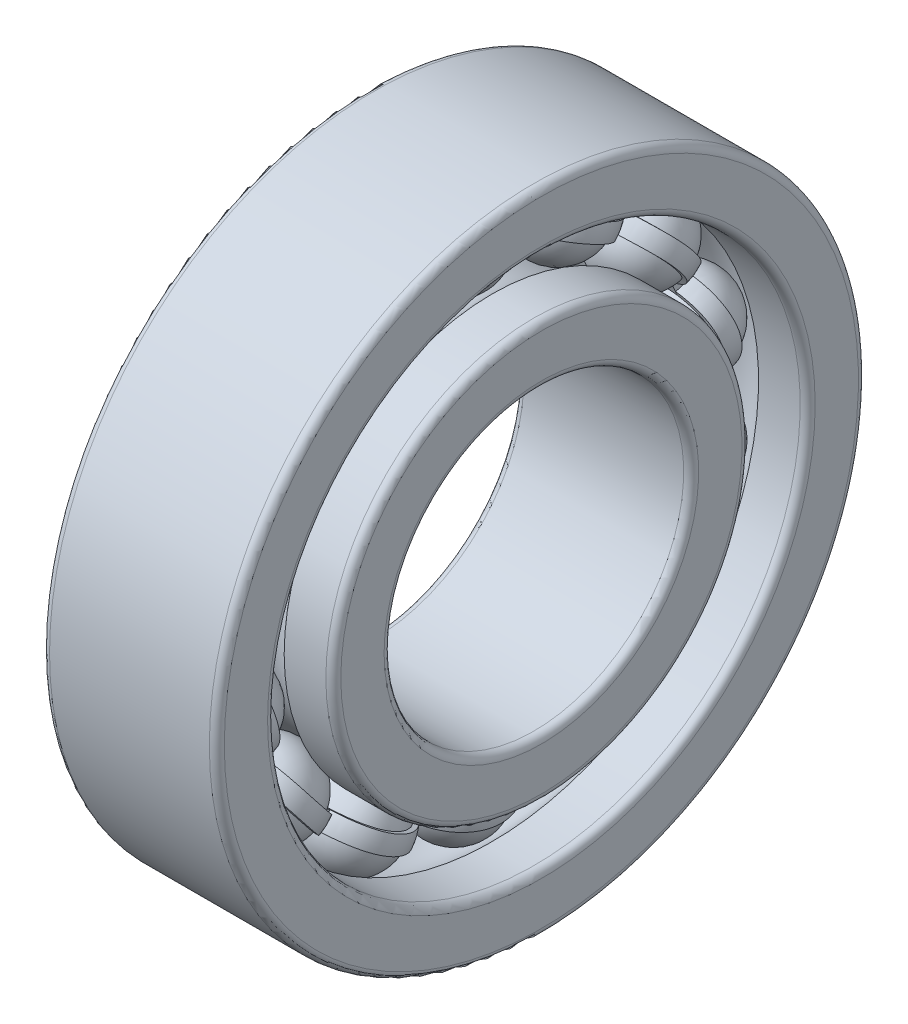
from build123d import *

# Parameters (mm, degrees)
SKETCH_5_W               = 0.5249999999999999
SKETCH_5_H               = 0.34999999999999964
PATTERN_CIRCULAR_5_COUNT = 14
PATTERN_CIRCULAR_2_COUNT = 14


with BuildPart() as part:
    # 草图2 → 旋转1 (revolve)
    with BuildSketch(Plane.XY):
        with BuildLine():
            Line((1.6000000000000028, 3), (-1.5999999999999979, 2.999999999999999))
            ThreePointArc((-1.5999999999999979, 2.999999999999999), (-1.7060660171779807, 3.043933982822017), (-1.749999999999999, 3.15))
            Line((-1.749999999999999, 3.15), (-1.7499999999999984, 4.016666666666998))
            ThreePointArc((-1.7499999999999984, 4.016666666666998), (-1.7060660171779811, 4.122732683844981), (-1.5999999999999985, 4.166666666666999))
            Line((-1.5999999999999985, 4.166666666666999), (-0.6521864934378441, 4.166666666666999))
            ThreePointArc((-0.6521864934378441, 4.166666666666999), (9.9e-16, 3.874999999999917), (0.6521864934378441, 4.166666666666999))
            Line((0.6521864934378441, 4.166666666666999), (1.600000000000003, 4.166666666666999))
            ThreePointArc((1.600000000000003, 4.166666666666999), (1.7060660171779847, 4.122732683844981), (1.7500000000000024, 4.016666666666999))
            Line((1.7500000000000024, 4.016666666666999), (1.7500000000000027, 3.15))
            ThreePointArc((1.7500000000000027, 3.15), (1.7060660171779847, 3.043933982822018), (1.6000000000000028, 3))
        make_face()
        with BuildLine():
            Line((-1.7499999999999984, 6.349999999999998), (-1.749999999999998, 5.483333333333333))
            ThreePointArc((-1.749999999999998, 5.483333333333333), (-1.7060660171779802, 5.3772673161553515), (-1.5999999999999979, 5.333333333333334))
            Line((-1.5999999999999979, 5.333333333333334), (-0.652186493437546, 5.333333333333332))
            ThreePointArc((-0.652186493437546, 5.333333333333332), (8e-16, 5.625000000000076), (0.652186493437546, 5.333333333333332))
            Line((0.652186493437546, 5.333333333333332), (1.6000000000000028, 5.333333333333332))
            ThreePointArc((1.6000000000000028, 5.333333333333332), (1.7060660171779845, 5.37726731615535), (1.7500000000000018, 5.483333333333332))
            Line((1.7500000000000018, 5.483333333333332), (1.7500000000000029, 6.349999999999998))
            ThreePointArc((1.7500000000000029, 6.349999999999998), (1.706066017177985, 6.456066017177981), (1.6000000000000025, 6.499999999999999))
            Line((1.6000000000000025, 6.499999999999999), (-1.599999999999998, 6.499999999999999))
            ThreePointArc((-1.599999999999998, 6.499999999999999), (-1.7060660171779811, 6.456066017177981), (-1.7499999999999984, 6.349999999999998))
        make_face()
    revolve(axis=Axis((-3.4999999999999996, 0, 0), (1, 0, 0)))


with BuildPart() as body_2:
    # 草图5 → 旋转3 (revolve)
    with BuildSketch(Plane.XY):
        with Locations((2.03e-15, 4.749999999999999)):
            Rectangle(SKETCH_5_W, SKETCH_5_H)
    revolve(axis=Axis((-19.927092192426834, 0, 0), (1, 0, 0)))



with BuildPart() as body_3:
    # 草图3 → 旋转2 (revolve)
    with BuildSketch(Plane.XY):
        with BuildLine():
            ThreePointArc((0.9624999999999972, 4.749999999999999), (1.9e-16, 5.712499999999992), (-0.962499999999997, 4.749999999999999))
            Line((-0.9624999999999969, 4.749999999999999), (0.9624999999999969, 4.749999999999999))
        make_face()
    revolve(axis=Axis((-0.9624999999999969, 4.749999999999999, 0), (1, 0, 0)))


with BuildPart() as pattern_circular_5_1:
    # 阵列(圆周)5: pattern copy
    add(body_3.part.rotate(Axis((-3.850000000000002, 0, 0), (1, 0, 0)), 1 * 360 / PATTERN_CIRCULAR_5_COUNT))


with BuildPart() as pattern_circular_5_2:
    # 阵列(圆周)5: pattern copy
    add(body_3.part.rotate(Axis((-3.850000000000002, 0, 0), (1, 0, 0)), 2 * 360 / PATTERN_CIRCULAR_5_COUNT))


with BuildPart() as pattern_circular_5_3:
    # 阵列(圆周)5: pattern copy
    add(body_3.part.rotate(Axis((-3.850000000000002, 0, 0), (1, 0, 0)), 3 * 360 / PATTERN_CIRCULAR_5_COUNT))


with BuildPart() as pattern_circular_5_4:
    # 阵列(圆周)5: pattern copy
    add(body_3.part.rotate(Axis((-3.850000000000002, 0, 0), (1, 0, 0)), 4 * 360 / PATTERN_CIRCULAR_5_COUNT))


with BuildPart() as pattern_circular_5_5:
    # 阵列(圆周)5: pattern copy
    add(body_3.part.rotate(Axis((-3.850000000000002, 0, 0), (1, 0, 0)), 5 * 360 / PATTERN_CIRCULAR_5_COUNT))


with BuildPart() as pattern_circular_5_6:
    # 阵列(圆周)5: pattern copy
    add(body_3.part.rotate(Axis((-3.850000000000002, 0, 0), (1, 0, 0)), 6 * 360 / PATTERN_CIRCULAR_5_COUNT))


with BuildPart() as pattern_circular_5_7:
    # 阵列(圆周)5: pattern copy
    add(body_3.part.rotate(Axis((-3.850000000000002, 0, 0), (1, 0, 0)), 7 * 360 / PATTERN_CIRCULAR_5_COUNT))


with BuildPart() as pattern_circular_5_8:
    # 阵列(圆周)5: pattern copy
    add(body_3.part.rotate(Axis((-3.850000000000002, 0, 0), (1, 0, 0)), 8 * 360 / PATTERN_CIRCULAR_5_COUNT))


with BuildPart() as pattern_circular_5_9:
    # 阵列(圆周)5: pattern copy
    add(body_3.part.rotate(Axis((-3.850000000000002, 0, 0), (1, 0, 0)), 9 * 360 / PATTERN_CIRCULAR_5_COUNT))


with BuildPart() as pattern_circular_5_10:
    # 阵列(圆周)5: pattern copy
    add(body_3.part.rotate(Axis((-3.850000000000002, 0, 0), (1, 0, 0)), 10 * 360 / PATTERN_CIRCULAR_5_COUNT))


with BuildPart() as pattern_circular_5_11:
    # 阵列(圆周)5: pattern copy
    add(body_3.part.rotate(Axis((-3.850000000000002, 0, 0), (1, 0, 0)), 11 * 360 / PATTERN_CIRCULAR_5_COUNT))


with BuildPart() as pattern_circular_5_12:
    # 阵列(圆周)5: pattern copy
    add(body_3.part.rotate(Axis((-3.850000000000002, 0, 0), (1, 0, 0)), 12 * 360 / PATTERN_CIRCULAR_5_COUNT))


with BuildPart() as pattern_circular_5_13:
    # 阵列(圆周)5: pattern copy
    add(body_3.part.rotate(Axis((-3.850000000000002, 0, 0), (1, 0, 0)), 13 * 360 / PATTERN_CIRCULAR_5_COUNT))


with BuildPart() as cut_revolve_1_tool:
    # 草图6 → 切除-旋转1 (revolve)
    with BuildSketch(Plane.XY):
        with BuildLine():
            Line((-0.9464572098092942, 4.924999999999999), (0.9464572098092942, 4.924999999999999))
            ThreePointArc((0.9464572098092942, 4.924999999999999), (2.49e-15, 5.712499999999993), (-0.9464572098092942, 4.924999999999999))
        make_face()
        with BuildLine():
            Line((-0.9464572098092942, 4.574999999999999), (0.9464572098092942, 4.574999999999999))
            ThreePointArc((0.9464572098092942, 4.574999999999999), (2.49e-15, 3.787499999999999), (-0.9464572098092942, 4.574999999999999))
        make_face()
    revolve(axis=Axis((-19.927092192426834, 0, 0), (1, 0, 0)))


with BuildPart() as part_1:
    add(part.part)

    # 切除-旋转1: cut by cut_revolve_1_tool
    add(cut_revolve_1_tool.part, mode=Mode.SUBTRACT)


with BuildPart() as body_3_1:
    add(body_3.part)

    # 切除-旋转1: cut by cut_revolve_1_tool
    add(cut_revolve_1_tool.part, mode=Mode.SUBTRACT)


with BuildPart() as pattern_circular_5_1_1:
    add(pattern_circular_5_1.part)

    # 切除-旋转1: cut by cut_revolve_1_tool
    add(cut_revolve_1_tool.part, mode=Mode.SUBTRACT)


with BuildPart() as pattern_circular_5_2_1:
    add(pattern_circular_5_2.part)

    # 切除-旋转1: cut by cut_revolve_1_tool
    add(cut_revolve_1_tool.part, mode=Mode.SUBTRACT)


with BuildPart() as pattern_circular_5_3_1:
    add(pattern_circular_5_3.part)

    # 切除-旋转1: cut by cut_revolve_1_tool
    add(cut_revolve_1_tool.part, mode=Mode.SUBTRACT)


with BuildPart() as pattern_circular_5_4_1:
    add(pattern_circular_5_4.part)

    # 切除-旋转1: cut by cut_revolve_1_tool
    add(cut_revolve_1_tool.part, mode=Mode.SUBTRACT)


with BuildPart() as pattern_circular_5_5_1:
    add(pattern_circular_5_5.part)

    # 切除-旋转1: cut by cut_revolve_1_tool
    add(cut_revolve_1_tool.part, mode=Mode.SUBTRACT)


with BuildPart() as pattern_circular_5_6_1:
    add(pattern_circular_5_6.part)

    # 切除-旋转1: cut by cut_revolve_1_tool
    add(cut_revolve_1_tool.part, mode=Mode.SUBTRACT)


with BuildPart() as pattern_circular_5_7_1:
    add(pattern_circular_5_7.part)

    # 切除-旋转1: cut by cut_revolve_1_tool
    add(cut_revolve_1_tool.part, mode=Mode.SUBTRACT)


with BuildPart() as pattern_circular_5_8_1:
    add(pattern_circular_5_8.part)

    # 切除-旋转1: cut by cut_revolve_1_tool
    add(cut_revolve_1_tool.part, mode=Mode.SUBTRACT)


with BuildPart() as pattern_circular_5_9_1:
    add(pattern_circular_5_9.part)

    # 切除-旋转1: cut by cut_revolve_1_tool
    add(cut_revolve_1_tool.part, mode=Mode.SUBTRACT)


with BuildPart() as pattern_circular_5_10_1:
    add(pattern_circular_5_10.part)

    # 切除-旋转1: cut by cut_revolve_1_tool
    add(cut_revolve_1_tool.part, mode=Mode.SUBTRACT)


with BuildPart() as pattern_circular_5_11_1:
    add(pattern_circular_5_11.part)

    # 切除-旋转1: cut by cut_revolve_1_tool
    add(cut_revolve_1_tool.part, mode=Mode.SUBTRACT)


with BuildPart() as pattern_circular_5_12_1:
    add(pattern_circular_5_12.part)

    # 切除-旋转1: cut by cut_revolve_1_tool
    add(cut_revolve_1_tool.part, mode=Mode.SUBTRACT)


with BuildPart() as pattern_circular_5_13_1:
    add(pattern_circular_5_13.part)

    # 切除-旋转1: cut by cut_revolve_1_tool
    add(cut_revolve_1_tool.part, mode=Mode.SUBTRACT)


with BuildPart() as body_2_1:
    add(body_2.part)

    add(body_3_1.part)  # 旋转4 merges body 3
    # 草图7 → 旋转4 (revolve)
    with BuildSketch(Plane.XY):
        with BuildLine():
            Line((-0.8750000000000794, 4.749999999999999), (0.8750000000000794, 4.749999999999999))
            ThreePointArc((0.8750000000000794, 4.749999999999999), (3.13e-15, 5.6250000000000755), (-0.8750000000000794, 4.749999999999999))
        make_face()
    revolve_4 = revolve(axis=Axis((-0.8750000000000794, 4.749999999999999, 0), (1, 0, 0)))

    # 阵列(圆周)2: 旋转4 ×14 about axis
    pattern_circular_2_axis = Axis((-3.850000000000002, 0, 0), (1, 0, 0))
    for i in range(1, PATTERN_CIRCULAR_2_COUNT):
        add(revolve_4.rotate(pattern_circular_2_axis, i * 360 / PATTERN_CIRCULAR_2_COUNT))


solid = Compound([part_1.part, pattern_circular_5_1_1.part, pattern_circular_5_2_1.part, pattern_circular_5_3_1.part, pattern_circular_5_4_1.part, pattern_circular_5_5_1.part, pattern_circular_5_6_1.part, pattern_circular_5_7_1.part, pattern_circular_5_8_1.part, pattern_circular_5_9_1.part, pattern_circular_5_10_1.part, pattern_circular_5_11_1.part, pattern_circular_5_12_1.part, pattern_circular_5_13_1.part, body_2_1.part])
